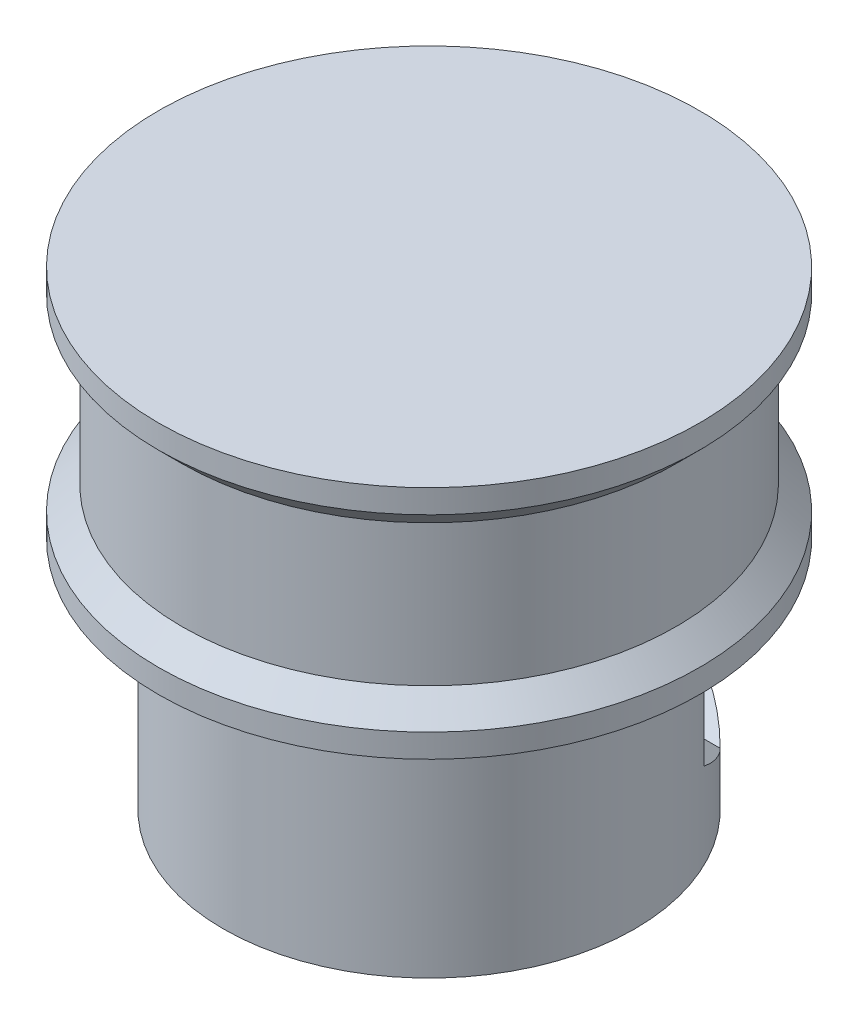
from build123d import *

# Parameters (mm, degrees)
SKETCH1_R                           = 11.1125
BOSS_EXTRUDE1_DEPTH                 = 12.7
CUT_EXTRUDE1_START                  = -12.7
SKETCH2_R                           = 4
CUT_EXTRUDE1_DEPTH                  = 12.7
CUT_EXTRUDE2_START                  = -12.7
SKETCH3_R                           = 4.7625
CUT_EXTRUDE2_DEPTH                  = 12.7
CUT_EXTRUDE3_REACH                  = 31.869
CUT_EXTRUDE4_DEPTH                  = 4
CUT_EXTRUDE4_DIRECTION_2_REACH      = 26.756
CUT_EXTRUDE4_DIRECTION_2_END_RADIUS = 11.1125
M3_CLEARANCE_HOLE1_D                = 3.4
CUT_EXTRUDE5_REACH                  = 23.999
SKETCH9_R                           = 3.5
SKETCH10_R                          = 14.605
BOSS_EXTRUDE2_DEPTH                 = 12.7
CUT_EXTRUDE6_START                  = -2.54
SKETCH11_R                          = 14.605
SKETCH11_R_2                        = 13.335
CUT_EXTRUDE6_DEPTH                  = 7.62
CHAMFER1_SIZE                       = 1.27


# Read off the part's stored shape, not the designer's step: Split1
with BuildPart() as part:
    # Sketch1 → Boss-Extrude1 (new, symmetric)
    with BuildSketch(Plane(origin=(0, 0, 0), x_dir=(1, 0, 0), z_dir=(0, 1, 0))):
        with Locations(Location((0, 0, 0), (0, 0, 270))):
            Circle(SKETCH1_R)
    extrude(amount=BOSS_EXTRUDE1_DEPTH, both=True)

    # Sketch2 → Cut-Extrude1 (cut)
    with BuildSketch(Plane(origin=(0, 12.7, 0), x_dir=(1, 0, 0), z_dir=(0, 1, 0)).offset(CUT_EXTRUDE1_START)):
        with Locations(Location((0, 0, 0), (0, 0, 270))):
            Circle(SKETCH2_R)
    extrude(amount=CUT_EXTRUDE1_DEPTH, mode=Mode.SUBTRACT)

    # Sketch3 → Cut-Extrude2 (cut)
    with BuildSketch(Plane.XZ.offset(12.7).offset(CUT_EXTRUDE2_START)):
        with Locations(Location((0, 0, 0), (0, 0, 270))):
            Circle(SKETCH3_R)
    extrude(amount=CUT_EXTRUDE2_DEPTH, mode=Mode.SUBTRACT)

    # Sketch4 → Cut-Extrude3 (cut, up to next)
    with BuildSketch(Plane(origin=(0, 12.7, 0), x_dir=(1, 0, 0), z_dir=(0, 1, 0)), mode=Mode.PRIVATE) as cut_extrude3_sk1:
        with BuildLine():
            Line((-1, 3.872983346), (-1, 11.067414163))
            ThreePointArc((-1, 11.067414163), (0, 11.1125), (1, 11.067414163))
            Line((1, 11.067414163), (1, 3.872983346))
            ThreePointArc((1, 3.872983346), (0, 4), (-1, 3.872983346))
        make_face()
    cut_extrude3_tool1 = extrude(cut_extrude3_sk1.sketch, amount=-CUT_EXTRUDE3_REACH, mode=Mode.PRIVATE) & part.part
    add(cut_extrude3_tool1.solids().sort_by_distance((0, 12.7, -7.527621))[0], mode=Mode.SUBTRACT)

    # Sketch5 → Cut-Extrude4 (cut)
    with BuildSketch(Plane(origin=(7, 0, 0), x_dir=(0, 0, -1), z_dir=(1, 0, 0))):
        Polygon((7.86187193, 2.885898385), (10.86187193, 4.617949192), (10.86187193, 8.082050808), (7.86187193, 9.814101615), (4.86187193, 8.082050808), (4.86187193, 4.617949192), align=None)
        Polygon((7.86187193, -9.814101615), (10.86187193, -8.082050808), (10.86187193, -4.617949192), (7.86187193, -2.885898385), (4.86187193, -4.617949192), (4.86187193, -8.082050808), align=None)
    extrude(amount=-CUT_EXTRUDE4_DEPTH, mode=Mode.SUBTRACT)

    # Cut-Extrude4 direction 2: up to this cylinder (the profile starts inside it)
    cut_extrude4_direction_2_end = Plane(origin=(0, 0, 0), z_dir=(0, -1, 0)) * Cylinder(CUT_EXTRUDE4_DIRECTION_2_END_RADIUS, 89.437, mode=Mode.PRIVATE)
    # Sketch5 → Cut-Extrude4 direction 2 (cut, up to the surface)
    with BuildSketch(Plane(origin=(7, 0, 0), x_dir=(0, 0, -1), z_dir=(1, 0, 0)), mode=Mode.PRIVATE) as cut_extrude4_direction_2_sk1:
        Polygon((7.86187193, 2.885898385), (10.86187193, 4.617949192), (10.86187193, 8.082050808), (7.86187193, 9.814101615), (4.86187193, 8.082050808), (4.86187193, 4.617949192), align=None)
    cut_extrude4_direction_2_tool1 = extrude(cut_extrude4_direction_2_sk1.sketch, amount=CUT_EXTRUDE4_DIRECTION_2_REACH, mode=Mode.PRIVATE) & cut_extrude4_direction_2_end
    add(cut_extrude4_direction_2_tool1.solids().sort_by_distance((7, 6.35, -7.861872))[0], mode=Mode.SUBTRACT)
    # Sketch5 → Cut-Extrude4 direction 2 (cut, up to the surface)
    with BuildSketch(Plane(origin=(7, 0, 0), x_dir=(0, 0, -1), z_dir=(1, 0, 0)), mode=Mode.PRIVATE) as cut_extrude4_direction_2_sk2:
        Polygon((7.86187193, -9.814101615), (10.86187193, -8.082050808), (10.86187193, -4.617949192), (7.86187193, -2.885898385), (4.86187193, -4.617949192), (4.86187193, -8.082050808), align=None)
    cut_extrude4_direction_2_tool2 = extrude(cut_extrude4_direction_2_sk2.sketch, amount=CUT_EXTRUDE4_DIRECTION_2_REACH, mode=Mode.PRIVATE) & cut_extrude4_direction_2_end
    add(cut_extrude4_direction_2_tool2.solids().sort_by_distance((7, -6.35, -7.861872))[0], mode=Mode.SUBTRACT)

    # M3 Clearance Hole1 (through all)
    with Locations(Plane(origin=(3, 0, 0), x_dir=(0, 0, -1), z_dir=(1, 0, 0))):
        with Locations((7.86187193, 6.35), (7.86187193, -6.35)):
            Hole(M3_CLEARANCE_HOLE1_D / 2)

    # Sketch9 → Cut-Extrude5 (cut, up to next)
    with BuildSketch(Plane(origin=(-3, 0, 0), x_dir=(0, 0, -1), z_dir=(1, 0, 0)), mode=Mode.PRIVATE) as cut_extrude5_sk1:
        with Locations((7.86187193, 6.35)):
            Circle(SKETCH9_R)
    cut_extrude5_tool1 = extrude(cut_extrude5_sk1.sketch, amount=-CUT_EXTRUDE5_REACH, mode=Mode.PRIVATE) & part.part
    # Sketch9 → Cut-Extrude5 (cut, up to next)
    with BuildSketch(Plane(origin=(-3, 0, 0), x_dir=(0, 0, -1), z_dir=(1, 0, 0)), mode=Mode.PRIVATE) as cut_extrude5_sk2:
        with Locations((7.86187193, -6.35)):
            Circle(SKETCH9_R)
    cut_extrude5_tool2 = extrude(cut_extrude5_sk2.sketch, amount=-CUT_EXTRUDE5_REACH, mode=Mode.PRIVATE) & part.part
    add(cut_extrude5_tool1.solids().sort_by_distance((-3, 6.35, -7.861872))[0], mode=Mode.SUBTRACT)
    add(cut_extrude5_tool2.solids().sort_by_distance((-3, -6.35, -7.861872))[0], mode=Mode.SUBTRACT)


with BuildPart() as body_2:
    # Split1: the piece on the far side of the plane
    add(part.part)
    split(bisect_by=Plane(origin=(0, 0, 0), x_dir=(1, 0, 0), z_dir=(0, 1, 0)), keep=Keep.BOTTOM)

    # Sketch10 → Boss-Extrude2 (add)
    with BuildSketch(Plane(origin=(0, 0, 0), x_dir=(1, 0, 0), z_dir=(0, 1, 0))):
        with Locations(Location((0, 0, 0), (0, 0, 270))):
            Circle(SKETCH10_R)
    extrude(amount=BOSS_EXTRUDE2_DEPTH)

    # Sketch11 → Cut-Extrude6 (cut)
    with BuildSketch(Plane(origin=(0, 12.7, 0), x_dir=(1, 0, 0), z_dir=(0, 1, 0)).offset(CUT_EXTRUDE6_START)):
        with Locations(Location((0, 0, 0), (0, 0, 270))):
            Circle(SKETCH11_R)
        with Locations(Location((0, 0, 0), (0, 0, 270))):
            Circle(SKETCH11_R_2, mode=Mode.SUBTRACT)
    extrude(amount=-CUT_EXTRUDE6_DEPTH, mode=Mode.SUBTRACT)

    # Chamfer1
    chamfer1_edges = [body_2.edges().sort_by_distance(p)[0] for p in [
        (0, 10.16, -14.605),
        (0, 2.54, -14.605),
    ]]
    chamfer(chamfer1_edges, length=CHAMFER1_SIZE - 0.0001)  # a hair under: the kernel refuses the full size


with BuildPart() as part_1:
    add(part.part)

    # Split1
    split(bisect_by=Plane(origin=(0, 0, 0), x_dir=(1, 0, 0), z_dir=(0, 1, 0)), keep=Keep.TOP)


solid = body_2.part
